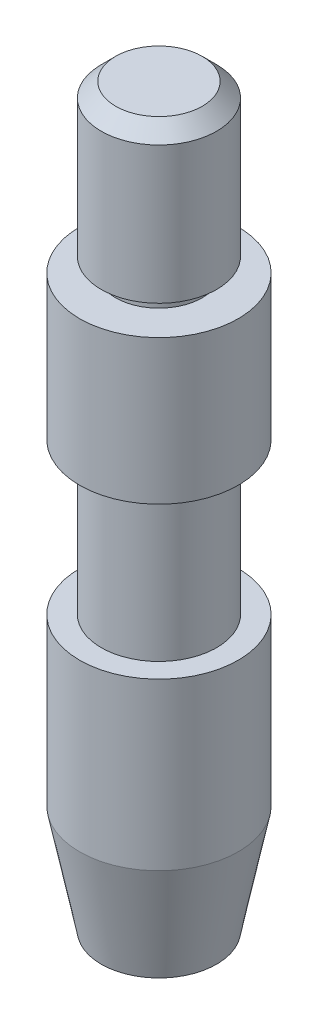
from build123d import *

# Parameters (mm, degrees)
ESQUISSE2_R        = 5.5
BOSS_EXTRU_2_DEPTH = 19
CHANFREIN1_SIZE    = 1.5
CHANFREIN1_SIZE2   = 7.5
ESQUISSE8_R        = 4
BOSS_EXTRU_3_DEPTH = 10.5
ESQUISSE9_R        = 5.5
BOSS_EXTRU_4_DEPTH = 10
ESQUISSE10_R       = 3
BOSS_EXTRU_5_DEPTH = 1
ESQUISSE12_R       = 4
BOSS_EXTRU_6_DEPTH = 10.5
CHANFREIN2_SIZE    = 1


with BuildPart() as part:
    # Esquisse2 → Boss.-Extru.2 (new body)
    with BuildSketch(Plane(origin=(0, 0, 0), x_dir=(1, 0, 0), z_dir=(0, 1, 0))):
        Circle(ESQUISSE2_R)
    extrude(amount=BOSS_EXTRU_2_DEPTH)

    # Chanfrein1
    chanfrein1_edges = [part.edges().sort_by_distance(p)[0] for p in [
        (-5.5, 0, 0),
    ]]
    chanfrein1_side = [part.faces().sort_by_distance(p)[0] for p in [
        (0, 0, 0),
    ]]
    chamfer(chanfrein1_edges, length=CHANFREIN1_SIZE, length2=CHANFREIN1_SIZE2, reference=chanfrein1_side[0])

    # Esquisse8 → Boss.-Extru.3 (add)
    with BuildSketch(Plane(origin=(0, 19, 0), x_dir=(1, 0, 0), z_dir=(0, 1, 0))):
        Circle(ESQUISSE8_R)
    extrude(amount=BOSS_EXTRU_3_DEPTH)

    # Esquisse9 → Boss.-Extru.4 (add)
    with BuildSketch(Plane(origin=(0, 29.5, 0), x_dir=(1, 0, 0), z_dir=(0, 1, 0))):
        Circle(ESQUISSE9_R)
    extrude(amount=BOSS_EXTRU_4_DEPTH)

    # Esquisse10 → Boss.-Extru.5 (add)
    with BuildSketch(Plane(origin=(0, 39.5, 0), x_dir=(1, 0, 0), z_dir=(0, 1, 0))):
        Circle(ESQUISSE10_R)
    extrude(amount=BOSS_EXTRU_5_DEPTH)

    # Esquisse12 → Boss.-Extru.6 (add)
    with BuildSketch(Plane(origin=(0, 40.5, 0), x_dir=(1, 0, 0), z_dir=(0, 1, 0))):
        Circle(ESQUISSE12_R)
    extrude(amount=BOSS_EXTRU_6_DEPTH)

    # Chanfrein2
    chanfrein2_edges = [part.edges().sort_by_distance(p)[0] for p in [
        (-4, 51, 0),
    ]]
    chamfer(chanfrein2_edges, length=CHANFREIN2_SIZE)


solid = part.part
